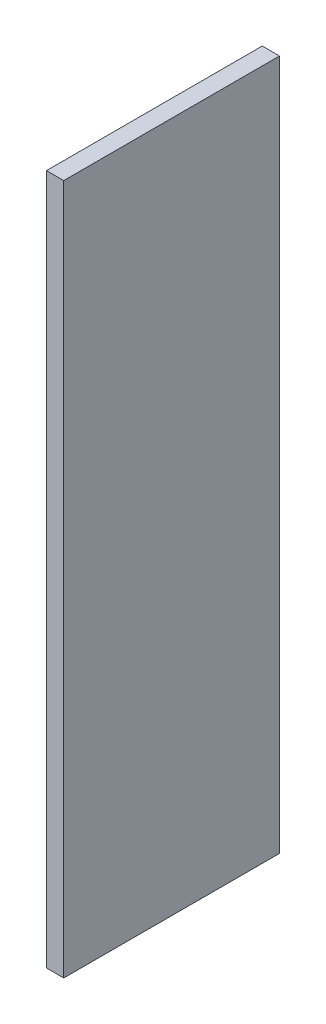
from build123d import *

# Parameters (mm, degrees)
SKETCH1_W           = 2.54
SKETCH1_H           = 31.75
BOSS_EXTRUDE1_DEPTH = 101.6
SKETCH5_R           = 4.7625
SKETCH5_R_2         = 3.175
BOSS_EXTRUDE3_DEPTH = 6.35


with BuildPart() as part:
    # Sketch1 → Boss-Extrude1 (new body)
    with BuildSketch(Plane(origin=(0, 0, 0), x_dir=(1, 0, 0), z_dir=(0, 1, 0))):
        with Locations((1.27, 15.875)):
            Rectangle(SKETCH1_W, SKETCH1_H)
    extrude(amount=BOSS_EXTRUDE1_DEPTH)

    # Sketch5 → Boss-Extrude3 (add)
    # profile 1 of 2: a face of its own
    with BuildSketch(Plane(origin=(0, 0, 0), x_dir=(0, 0, -1), z_dir=(1, 0, 0))):
        with Locations((15.875, 19.05)):
            Circle(SKETCH5_R)
        with Locations((15.875, 19.05)):
            Circle(SKETCH5_R_2, mode=Mode.SUBTRACT)
    # profile 2 of 2: a face of its own
    with BuildSketch(Plane(origin=(0, 0, 0), x_dir=(0, 0, -1), z_dir=(1, 0, 0))):
        with Locations((15.875, 83.383819167)):
            Circle(SKETCH5_R)
        with Locations((15.875, 83.383819167)):
            Circle(SKETCH5_R_2, mode=Mode.SUBTRACT)
    extrude(amount=-BOSS_EXTRUDE3_DEPTH)


solid = part.part
